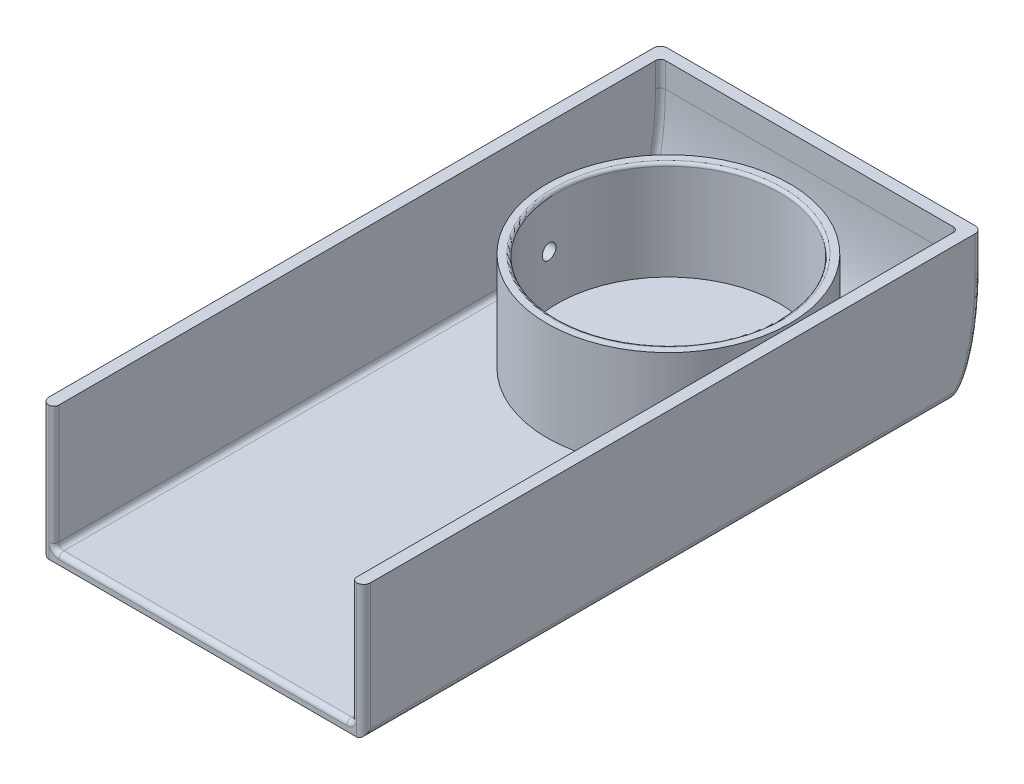
from build123d import *

# Parameters (mm, degrees)
SKETCH1_W           = 65
SKETCH1_H           = 125
BOSS_EXTRUDE1_DEPTH = 2
SKETCH2_W           = 65
SKETCH2_H           = 125
SKETCH2_W_2         = 60.2
SKETCH2_H_2         = 120.2
BOSS_EXTRUDE2_DEPTH = 25
SKETCH3_W           = 60.2
SKETCH3_H           = 25
CUT_EXTRUDE1_DEPTH  = 25
FILLET1_SIZE        = 20
FILLET1_SIZE_2      = 6
FILLET2_SIZE        = 20
FILLET2_SIZE_2      = 6
FILLET3_R           = 1
FILLET4_R           = 1.4
SKETCH5_R           = 24.5
SKETCH5_R_2         = 22.5
BOSS_EXTRUDE3_DEPTH = 20
FILLET6_R           = 0.6
SKETCH6_R           = 1.5
CUT_EXTRUDE3_DEPTH  = 20


# Some blends are built 0.0001 mm under size
with BuildPart() as part:
    # Sketch1 → Boss-Extrude1 (new body)
    with BuildSketch(Plane(origin=(0, 0, 0), x_dir=(1, 0, 0), z_dir=(0, 1, 0))):
        with Locations((32.5, -62.5)):
            Rectangle(SKETCH1_W, SKETCH1_H)
    extrude(amount=BOSS_EXTRUDE1_DEPTH)

    # Sketch2 → Boss-Extrude2 (add)
    with BuildSketch(Plane(origin=(0, 2, 0), x_dir=(1, 0, 0), z_dir=(0, 1, 0))):
        with Locations((32.5, -62.5)):
            Rectangle(SKETCH2_W, SKETCH2_H)
        with Locations((32.5, -62.5)):
            Rectangle(SKETCH2_W_2, SKETCH2_H_2, mode=Mode.SUBTRACT)
    extrude(amount=BOSS_EXTRUDE2_DEPTH)

    # Sketch3 → Cut-Extrude1 (cut)
    with BuildSketch(Plane(origin=(0, 0, 122.6), x_dir=(-1, 0, 0), z_dir=(0, 0, -1))):
        with Locations((-32.5, 14.5)):
            Rectangle(SKETCH3_W, SKETCH3_H)
    extrude(amount=-CUT_EXTRUDE1_DEPTH, mode=Mode.SUBTRACT)

    # Fillet1
    # an asymmetric fillet: 20, 6 mm, written as the material it adds along each edge
    with BuildSketch(Plane(origin=(62.6, 2, 2.4), x_dir=(0, 1, 0), z_dir=(-1, 0, 0))) as fillet1_piece_1:
        with BuildLine():
            Bezier((FILLET1_SIZE, 0), (0, 0), (0, -FILLET1_SIZE_2), weights=[1, 0.707106781, 1])
            Line((0, -FILLET1_SIZE_2), (0, 0))
            Line((0, 0), (FILLET1_SIZE, 0))
        make_face()
    extrude(amount=60.2)

    # Fillet2
    # an asymmetric fillet: 20, 6 mm, written as the material it takes off along each edge
    with BuildSketch(Plane(origin=(-50, 0, 0), x_dir=(0, 1, 0), z_dir=(1, 0, 0))) as fillet2_piece_1:
        with BuildLine():
            Bezier((FILLET2_SIZE, 0), (0, 0), (0, FILLET2_SIZE_2), weights=[1, 0.707106781, 1])
            Line((0, FILLET2_SIZE_2), (0, 0))
            Line((0, 0), (FILLET2_SIZE, 0))
        make_face()
    extrude(amount=165, mode=Mode.SUBTRACT)

    # Fillet3
    fillet3_edges = [part.edges().sort_by_distance(p)[0] for p in [
        (62.6, 14.5, 125),
        (2.4, 14.5, 125),
        (2.4, 24.5, 2.4),
        (2.4, 11.09343012, 3.370665451),
        (62.6, 24.5, 2.4),
        (62.6, 11.09343012, 3.370665451),
        (32.5, 2, 125),
        (2.4, 2, 66.7),
        (62.6, 2, 66.7),
    ]]
    fillet(fillet3_edges, radius=FILLET3_R)

    # Fillet4
    fillet4_edges = [part.edges().sort_by_distance(p)[0] for p in [
        (65, 23.5, 0),
        (65, 9.087328982, 0.971856703),
        (0, 23.5, 0),
        (0, 9.087328982, 0.971856703),
        (65, 0, 65.5),
        (0, 0, 65.5),
        (65, 13.5, 125),
        (0, 13.5, 125),
    ]]
    fillet(fillet4_edges, radius=FILLET4_R - 0.0001)  # a hair under: the kernel refuses the full size

    # Sketch5 → Boss-Extrude3 (add)
    with BuildSketch(Plane(origin=(0, 2, 0), x_dir=(1, 0, 0), z_dir=(0, 1, 0))):
        with Locations(Location((32.5, -30.9, 0), (0, 0, 66.688554318))):
            Circle(SKETCH5_R)
        with Locations(Location((32.5, -30.9, 0), (0, 0, 270))):
            Circle(SKETCH5_R_2, mode=Mode.SUBTRACT)
    extrude(amount=BOSS_EXTRUDE3_DEPTH)

    # Fillet6
    fillet6_edges = [part.edges().sort_by_distance(p)[0] for p in [
        (32.5, 22, 8.4),
    ]]
    fillet(fillet6_edges, radius=FILLET6_R)

    # Sketch6 → Cut-Extrude3 (cut)
    with BuildSketch(Plane(origin=(2.4, 0, 0), x_dir=(0, 0, -1), z_dir=(1, 0, 0))):
        with Locations(Location((-32.609018745, 12, 0), (0, 0, 180))):
            Circle(SKETCH6_R)
    extrude(amount=CUT_EXTRUDE3_DEPTH, mode=Mode.SUBTRACT)


solid = part.part
